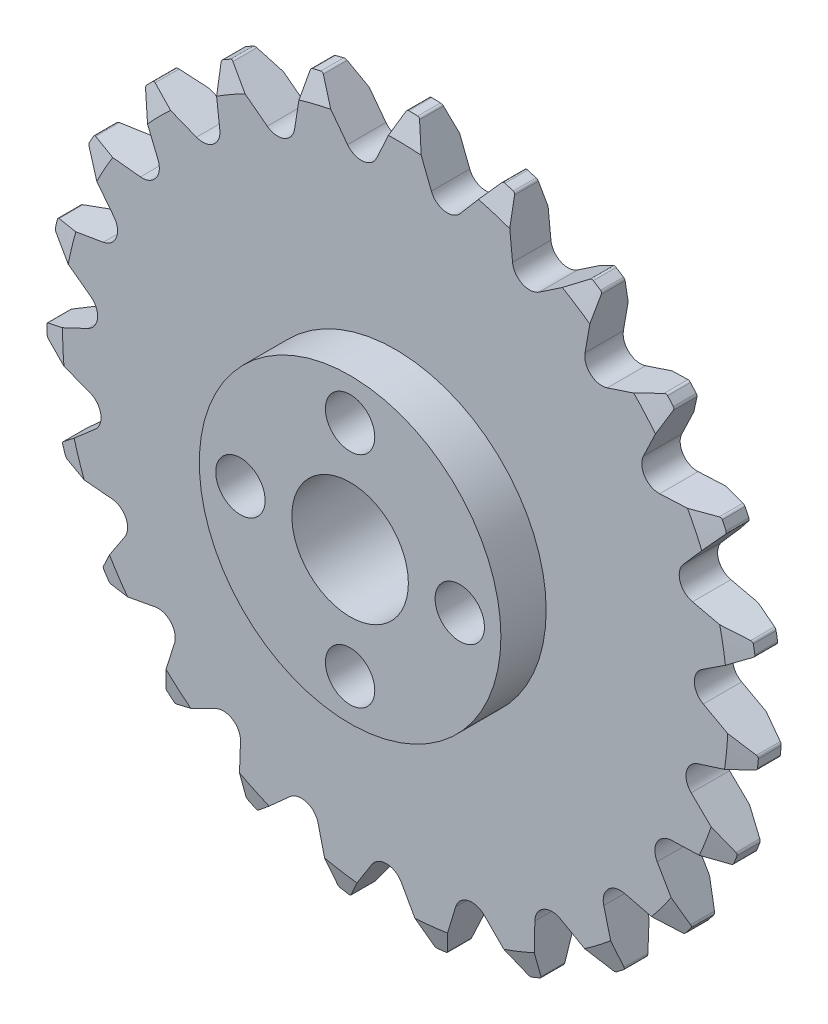
from build123d import *

# Parameters (mm, degrees)
SKETCH1_W                  = 26
SKETCH1_H                  = 2.7999944
CUT_EXTRUDE1_DEPTH         = 37.876008036
CUT_EXTRUDE2_DEPTH         = 37.876008036
CUT_EXTRUDE3_DEPTH         = 37.876008036
CUT_EXTRUDE4_DEPTH         = 37.876008036
CUT_EXTRUDE5_DEPTH         = 37.876008036
CUT_EXTRUDE6_DEPTH         = 37.876008036
CUT_EXTRUDE7_DEPTH         = 37.876008036
CUT_EXTRUDE8_DEPTH         = 37.876008036
CUT_EXTRUDE9_DEPTH         = 37.876008036
CUT_EXTRUDE10_DEPTH        = 37.876008036
CUT_EXTRUDE11_DEPTH        = 37.876008036
CUT_EXTRUDE12_DEPTH        = 37.876008036
CUT_EXTRUDE13_DEPTH        = 37.876008036
CUT_EXTRUDE14_DEPTH        = 37.876008036
CUT_EXTRUDE15_DEPTH        = 37.876008036
CUT_EXTRUDE16_DEPTH        = 37.871323245
CUT_EXTRUDE17_DEPTH        = 37.871323245
CUT_EXTRUDE18_DEPTH        = 37.871323245
CUT_EXTRUDE19_DEPTH        = 37.871323245
CUT_EXTRUDE20_DEPTH        = 37.871323245
CUT_EXTRUDE21_DEPTH        = 37.871323245
CUT_EXTRUDE22_DEPTH        = 37.870167928
CUT_EXTRUDE23_DEPTH        = 37.870167928
SKETCH25_W                 = 11
SKETCH25_H                 = 3.302
F_8_0_8_DIAMETER_HOLE1_D   = 8.5
F_3_6_3_6_DIAMETER_HOLE1_D = 3.6
F_3_6_3_6_DIAMETER_HOLE2_D = 3.6
FILLET1_R                  = 0.2


with BuildPart() as part:
    # Sketch1 → Revolve1 (revolve)
    with BuildSketch(Plane(origin=(0, 0, 0), x_dir=(1, 0, 0), z_dir=(0, 1, 0))):
        with Locations((13, 1.3999972)):
            Rectangle(SKETCH1_W, SKETCH1_H)
    revolve(axis=Axis((0, 0, -2.7999944), (0, 0, 1)))

    # Sketch2 → Cut-Extrude1 (cut, through all)
    with BuildSketch(Plane(origin=(0, 0, -2.7999944), x_dir=(-1, 0, 0), z_dir=(0, 0, -1))):
        with BuildLine():
            Line((18.801313039, 17.958580902), (17.308486788, 14.31139503))
            ThreePointArc((17.308486788, 14.31139503), (17.465043178, 13.088273063), (18.595024492, 12.594634046))
            Line((18.595024492, 12.594634046), (22.514630462, 13.003515492))
            ThreePointArc((22.514630462, 13.003515492), (20.80600791, 15.591986238), (18.801313039, 17.958580902))
        make_face()
    extrude(amount=-CUT_EXTRUDE1_DEPTH, mode=Mode.SUBTRACT)

    # Sketch3 → Cut-Extrude2 (cut, through all)
    with BuildSketch(Plane(origin=(0, 0, -2.7999944), x_dir=(-1, 0, 0), z_dir=(0, 0, -1))):
        with BuildLine():
            Line((22.949276492, 12.220094456), (20.527809316, 9.110915831))
            ThreePointArc((20.527809316, 9.110915831), (20.348565813, 7.890912137), (21.303462141, 7.110713283))
            Line((21.303462141, 7.110713283), (25.188033384, 6.446935261))
            ThreePointArc((25.188033384, 6.446935261), (24.24113224, 9.400399338), (22.949276492, 12.220094456))
        make_face()
    extrude(amount=-CUT_EXTRUDE2_DEPTH, mode=Mode.SUBTRACT)

    # Sketch4 → Cut-Extrude3 (cut, through all)
    with BuildSketch(Plane(origin=(0, 0, -2.7999944), x_dir=(-1, 0, 0), z_dir=(0, 0, -1))):
        with BuildLine():
            Line((25.395197093, 5.575299507), (22.224678136, 3.234721685))
            ThreePointArc((22.224678136, 3.234721685), (21.72292841, 2.108318355), (22.431919461, 1.099423446))
            Line((22.431919461, 1.099423446), (25.993355097, -0.587784666))
            ThreePointArc((25.993355097, -0.587784666), (25.878402688, 2.511627823), (25.395197093, 5.575299507))
        make_face()
    extrude(amount=-CUT_EXTRUDE3_DEPTH, mode=Mode.SUBTRACT)

    # Sketch5 → Cut-Extrude4 (cut, through all)
    with BuildSketch(Plane(origin=(0, 0, -2.7999944), x_dir=(-1, 0, 0), z_dir=(0, 0, -1))):
        with BuildLine():
            Line((25.957672102, -1.482989902), (22.273244249, -2.881376971))
            ThreePointArc((22.273244249, -2.881376971), (21.486200783, -3.830639754), (21.896703933, -4.993405599))
            Line((21.896703933, -4.993405599), (24.870868574, -7.578911293))
            ThreePointArc((24.870868574, -7.578911293), (25.596390394, -4.563419638), (25.957672102, -1.482989902))
        make_face()
    extrude(amount=-CUT_EXTRUDE4_DEPTH, mode=Mode.SUBTRACT)

    # Sketch6 → Cut-Extrude5 (cut, through all)
    with BuildSketch(Plane(origin=(0, 0, -2.7999944), x_dir=(-1, 0, 0), z_dir=(0, 0, -1))):
        with BuildLine():
            Line((24.594985319, -8.431292733), (20.669905729, -8.783777078))
            ThreePointArc((20.669905729, -8.783777078), (19.655939936, -9.485496836), (19.737510045, -10.715896595))
            Line((19.737510045, -10.715896595), (21.903823506, -14.00794474))
            ThreePointArc((21.903823506, -14.00794474), (23.416010921, -11.30001914), (24.594985319, -8.431292733))
        make_face()
    extrude(amount=-CUT_EXTRUDE5_DEPTH, mode=Mode.SUBTRACT)

    # Sketch7 → Cut-Extrude6 (cut, through all)
    with BuildSketch(Plane(origin=(0, 0, -2.7999944), x_dir=(-1, 0, 0), z_dir=(0, 0, -1))):
        with BuildLine():
            Line((21.40820099, -14.754285153), (17.53357486, -14.034724622))
            ThreePointArc((17.53357486, -14.034724622), (16.367887944, -14.436858011), (16.11447533, -15.643638561))
            Line((16.11447533, -15.643638561), (17.312272051, -19.398073008))
            ThreePointArc((17.312272051, -19.398073008), (19.498973038, -17.198547917), (21.40820099, -14.754285153))
        make_face()
    extrude(amount=-CUT_EXTRUDE6_DEPTH, mode=Mode.SUBTRACT)

    # Sketch8 → Cut-Extrude7 (cut, through all)
    with BuildSketch(Plane(origin=(0, 0, -2.7999944), x_dir=(-1, 0, 0), z_dir=(0, 0, -1))):
        with BuildLine():
            Line((16.633668329, -19.98301974), (13.096858955, -18.244780846))
            ThreePointArc((13.096858955, -18.244780846), (11.865904582, -18.317503472), (11.296303699, -19.411163421))
            Line((11.296303699, -19.411163421), (11.436748577, -23.349534942))
            ThreePointArc((11.436748577, -23.349534942), (14.135785527, -21.821539073), (16.633668329, -19.98301974))
        make_face()
    extrude(amount=-CUT_EXTRUDE7_DEPTH, mode=Mode.SUBTRACT)

    # Sketch9 → Cut-Extrude8 (cut, through all)
    with BuildSketch(Plane(origin=(0, 0, -2.7999944), x_dir=(-1, 0, 0), z_dir=(0, 0, -1))):
        with BuildLine():
            Line((10.625492582, -23.729705169), (7.688808935, -21.101705139))
            ThreePointArc((7.688808935, -21.101705139), (6.48388136, -20.839623497), (5.6403369, -21.739051089))
            Line((5.6403369, -21.739051089), (4.713013781, -25.569268685))
            ThreePointArc((4.713013781, -25.569268685), (7.724211471, -24.826126503), (10.625492582, -23.729705169))
        make_face()
    extrude(amount=-CUT_EXTRUDE8_DEPTH, mode=Mode.SUBTRACT)

    # Sketch10 → Cut-Extrude9 (cut, through all)
    with BuildSketch(Plane(origin=(0, 0, -2.7999944), x_dir=(-1, 0, 0), z_dir=(0, 0, -1))):
        with BuildLine():
            Line((3.829272659, -25.716466921), (1.71051513, -22.393612495))
            ThreePointArc((1.71051513, -22.393612495), (0.620978318, -21.816163983), (-0.433947885, -22.454652788))
            Line((-0.433947885, -22.454652788), (-2.360263687, -25.892646742))
            ThreePointArc((-2.360263687, -25.892646742), (0.739767985, -25.989473702), (3.829272659, -25.716466921))
        make_face()
    extrude(amount=-CUT_EXTRUDE9_DEPTH, mode=Mode.SUBTRACT)

    # Sketch11 → Cut-Extrude10 (cut, through all)
    with BuildSketch(Plane(origin=(0, 0, -2.7999944), x_dir=(-1, 0, 0), z_dir=(0, 0, -1))):
        with BuildLine():
            Line((-3.250946899, -25.795955967), (-4.394639757, -22.024688057))
            ThreePointArc((-4.394639757, -22.024688057), (-5.287979844, -21.174699388), (-6.47604874, -21.504895613))
            Line((-6.47604874, -21.504895613), (-9.258491195, -24.295685642))
            ThreePointArc((-9.258491195, -24.295685642), (-6.299540707, -25.225300531), (-3.250946899, -25.795955967))
        make_face()
    extrude(amount=-CUT_EXTRUDE10_DEPTH, mode=Mode.SUBTRACT)

    # Sketch12 → Cut-Extrude11 (cut, through all)
    with BuildSketch(Plane(origin=(0, 0, -2.7999944), x_dir=(-1, 0, 0), z_dir=(0, 0, -1))):
        with BuildLine():
            Line((-10.090058599, -23.962276968), (-10.173864317, -20.022293262))
            ThreePointArc((-10.173864317, -20.022293262), (-10.804752732, -18.962804207), (-12.037850686, -18.960218709))
            Line((-12.037850686, -18.960218709), (-15.470058766, -20.896824682))
            ThreePointArc((-15.470058766, -20.896824682), (-12.871641284, -22.590282217), (-10.090058599, -23.962276968))
        make_face()
    extrude(amount=-CUT_EXTRUDE11_DEPTH, mode=Mode.SUBTRACT)

    # Sketch13 → Cut-Extrude12 (cut, through all)
    with BuildSketch(Plane(origin=(0, 0, -2.7999944), x_dir=(-1, 0, 0), z_dir=(0, 0, -1))):
        with BuildLine():
            Line((-16.18083681, -20.351425506), (-15.198539903, -16.534936571))
            ThreePointArc((-15.198539903, -16.534936571), (-15.520186538, -15.344524588), (-16.706860316, -15.00934912))
            Line((-16.706860316, -15.00934912), (-20.534282848, -15.948141832))
            ThreePointArc((-20.534282848, -15.948141832), (-18.489111111, -18.279846015), (-16.18083681, -20.351425506))
        make_face()
    extrude(amount=-CUT_EXTRUDE12_DEPTH, mode=Mode.SUBTRACT)

    # Sketch14 → Cut-Extrude13 (cut, through all)
    with BuildSketch(Plane(origin=(0, 0, -2.7999944), x_dir=(-1, 0, 0), z_dir=(0, 0, -1))):
        with BuildLine():
            Line((-21.071556378, -15.231201916), (-19.096009313, -11.821259277))
            ThreePointArc((-19.096009313, -11.821259277), (-19.084559109, -10.588211776), (-20.136798545, -9.94530477))
            Line((-20.136798545, -9.94530477), (-24.07557311, -9.816658261))
            ThreePointArc((-24.07557311, -9.816658261), (-22.735328148, -12.613677259), (-21.071556378, -15.231201916))
        make_face()
    extrude(amount=-CUT_EXTRUDE13_DEPTH, mode=Mode.SUBTRACT)

    # Sketch15 → Cut-Extrude14 (cut, through all)
    with BuildSketch(Plane(origin=(0, 0, -2.7999944), x_dir=(-1, 0, 0), z_dir=(0, 0, -1))):
        with BuildLine():
            Line((-24.399495006, -8.981349757), (-21.577215071, -6.230853262))
            ThreePointArc((-21.577215071, -6.230853262), (-21.233517237, -5.046619734), (-22.073282546, -4.143662662))
            Line((-22.073282546, -4.143662662), (-25.831288253, -2.957118055))
            ThreePointArc((-25.831288253, -2.957118055), (-25.295369904, -6.012009764), (-24.399495006, -8.981349757))
        make_face()
    extrude(amount=-CUT_EXTRUDE14_DEPTH, mode=Mode.SUBTRACT)

    # Sketch16 → Cut-Extrude15 (cut, through all)
    with BuildSketch(Plane(origin=(0, 0, -2.7999944), x_dir=(-1, 0, 0), z_dir=(0, 0, -1))):
        with BuildLine():
            Line((-25.917834709, -2.065391975), (-22.458137497, -0.178333364))
            ThreePointArc((-22.458137497, -0.178333364), (-21.807682528, 0.869257006), (-22.372692159, 1.965295949))
            Line((-22.372692159, 1.965295949), (-25.671214916, 4.12173807))
            ThreePointArc((-25.671214916, 4.12173807), (-25.979369793, 1.035540992), (-25.917834709, -2.065391975))
        make_face()
    extrude(amount=-CUT_EXTRUDE15_DEPTH, mode=Mode.SUBTRACT)

    # Sketch17 → Cut-Extrude16 (cut, through all)
    with BuildSketch(Plane(origin=(0, 0, -2.7999944), x_dir=(-1, 0, 0), z_dir=(0, 0, -1))):
        with BuildLine():
            Line((-25.513967178, 5.003746482), (-21.673442603, 5.887412704))
            ThreePointArc((-21.673442603, 5.887412704), (-20.76447177, 6.720664931), (-21.012821543, 7.928497551))
            Line((-21.012821543, 7.928497551), (-23.607225007, 10.894903738))
            ThreePointArc((-23.607225007, 10.894903738), (-24.736598672, 8.00629041), (-25.513967178, 5.003746482))
        make_face()
    extrude(amount=-CUT_EXTRUDE16_DEPTH, mode=Mode.SUBTRACT)

    # Sketch18 → Cut-Extrude17 (cut, through all)
    with BuildSketch(Plane(origin=(0, 0, -2.7999944), x_dir=(-1, 0, 0), z_dir=(0, 0, -1))):
        with BuildLine():
            Line((-23.21784542, 11.701779953), (-19.281327621, 11.516516304))
            ThreePointArc((-19.281327621, 11.516516304), (-18.181255132, 12.073631883), (-18.09452608, 13.30367876))
            Line((-18.09452608, 13.30367876), (-19.792395215, 16.860044236))
            ThreePointArc((-19.792395215, 16.860044236), (-21.65922719, 14.383249894), (-23.21784542, 11.701779953))
        make_face()
    extrude(amount=-CUT_EXTRUDE17_DEPTH, mode=Mode.SUBTRACT)

    # Sketch19 → Cut-Extrude18 (cut, through all)
    with BuildSketch(Plane(origin=(0, 0, -2.7999944), x_dir=(-1, 0, 0), z_dir=(0, 0, -1))):
        with BuildLine():
            Line((-19.199762281, 17.531945937), (-15.459204775, 16.291492575))
            ThreePointArc((-15.459204775, 16.291492575), (-14.249617974, 16.531152791), (-13.834242395, 17.692186975))
            Line((-13.834242395, 17.692186975), (-14.509654015, 21.574752383))
            ThreePointArc((-14.509654015, 21.574752383), (-16.975489912, 19.693469533), (-19.199762281, 17.531945937))
        make_face()
    extrude(amount=-CUT_EXTRUDE18_DEPTH, mode=Mode.SUBTRACT)

    # Sketch20 → Cut-Extrude19 (cut, through all)
    with BuildSketch(Plane(origin=(0, 0, -2.7999944), x_dir=(-1, 0, 0), z_dir=(0, 0, -1))):
        with BuildLine():
            Line((-13.757720608, 22.061847694), (-10.490543432, 19.85820337))
            ThreePointArc((-10.490543432, 19.85820337), (-9.261151839, 19.762633722), (-8.547936239, 20.768546619))
            Line((-8.547936239, 20.768546619), (-8.150798153, 24.689359843))
            ThreePointArc((-8.150798153, 24.689359843), (-11.032758204, 23.543114628), (-13.757720608, 22.061847694))
        make_face()
    extrude(amount=-CUT_EXTRUDE19_DEPTH, mode=Mode.SUBTRACT)

    # Sketch21 → Cut-Extrude20 (cut, through all)
    with BuildSketch(Plane(origin=(0, 0, -2.7999944), x_dir=(-1, 0, 0), z_dir=(0, 0, -1))):
        with BuildLine():
            Line((-7.295331734, 24.955523134), (-4.743846474, 21.952122067))
            ThreePointArc((-4.743846474, 21.952122067), (-3.585828439, 21.528410517), (-2.627668756, 22.30459817))
            Line((-2.627668756, 22.30459817), (-1.187434879, 25.972870431))
            ThreePointArc((-1.187434879, 25.972870431), (-4.271777292, 25.646674614), (-7.295331734, 24.955523134))
        make_face()
    extrude(amount=-CUT_EXTRUDE20_DEPTH, mode=Mode.SUBTRACT)

    # Sketch22 → Cut-Extrude21 (cut, through all)
    with BuildSketch(Plane(origin=(0, 0, -2.7999944), x_dir=(-1, 0, 0), z_dir=(0, 0, -1))):
        with BuildLine():
            Line((-0.29188148, 25.998361587), (1.354679875, 22.417952294))
            ThreePointArc((1.354679875, 22.417952294), (2.355439453, 21.697523591), (3.487480897, 22.186419711))
            Line((3.487480897, 22.186419711), (5.863995007, 25.330092036))
            ThreePointArc((5.863995007, 25.330092036), (2.806021799, 25.84813807), (-0.29188148, 25.998361587))
        make_face()
    extrude(amount=-CUT_EXTRUDE21_DEPTH, mode=Mode.SUBTRACT)

    # Sketch23 → Cut-Extrude22 (cut, through all)
    with BuildSketch(Plane(origin=(0, 0, -2.7999944), x_dir=(-1, 0, 0), z_dir=(0, 0, -1))):
        with BuildLine():
            Line((6.733216289, 25.113020495), (7.352735815, 21.221145554))
            ThreePointArc((7.352735815, 21.221145554), (8.122015175, 20.257430599), (9.343980047, 20.422775999))
            Line((9.343980047, 20.422775999), (12.48051921, 22.808696593))
            ThreePointArc((12.48051921, 22.808696593), (9.675711091, 24.132563372), (6.733216289, 25.113020495))
        make_face()
    extrude(amount=-CUT_EXTRUDE22_DEPTH, mode=Mode.SUBTRACT)

    # Sketch24 → Cut-Extrude23 (cut, through all)
    with BuildSketch(Plane(origin=(0, 0, -2.7999944), x_dir=(-1, 0, 0), z_dir=(0, 0, -1))):
        with BuildLine():
            Line((13.258942208, 22.365161558), (12.805472976, 18.45046353))
            ThreePointArc((12.805472976, 18.45046353), (13.286218188, 17.314936652), (14.507478942, 17.144468418))
            Line((14.507478942, 17.144468418), (18.171420397, 18.595684466))
            ThreePointArc((18.171420397, 18.595684466), (15.827797154, 20.627186848), (13.258942208, 22.365161558))
        make_face()
    extrude(amount=-CUT_EXTRUDE23_DEPTH, mode=Mode.SUBTRACT)

    # Sketch25 → Revolve2 (revolve)
    with BuildSketch(Plane(origin=(0, 0, 0), x_dir=(1, 0, 0), z_dir=(0, 1, 0))):
        with Locations((5.5, -1.651)):
            Rectangle(SKETCH25_W, SKETCH25_H)
    revolve(axis=Axis((0, 0, 0), (0, 0, 1)))

    # Ø8.0 (8) Diameter Hole1 (through all)
    with Locations(Plane.XY.offset(3.302)):
        with Locations((0, 0)):
            Hole(F_8_0_8_DIAMETER_HOLE1_D / 2)

    # Ø3.6 (3.6) Diameter Hole1 (through all)
    with Locations(Plane.XY.offset(3.302)):
        with Locations((0, 8), (-8, 0), (0, -8)):
            Hole(F_3_6_3_6_DIAMETER_HOLE1_D / 2)

    # Ø3.6 (3.6) Diameter Hole2 (through all)
    with Locations(Plane(origin=(0, 0, -2.7999944), x_dir=(-1, 0, 0), z_dir=(0, 0, -1))):
        with Locations((-8, 0)):
            Hole(F_3_6_3_6_DIAMETER_HOLE2_D / 2)

    # Fillet1
    fillet1_edges = [part.edges().sort_by_distance(p)[0] for p in [
        (25.831288253, -2.957118055, -1.3999972),
        (25.917834709, -2.065391975, -1.3999972),
        (9.258491195, -24.295685642, -1.3999972),
        (10.090058599, -23.962276968, -1.3999972),
        (14.509654015, 21.574752383, -1.3999972),
        (13.757720608, 22.061847694, -1.3999972),
        (-13.258942208, 22.365161558, -1.3999972),
        (-12.48051921, 22.808696593, -1.3999972),
        (20.534282848, -15.948141832, -1.3999972),
        (21.071556378, -15.231201916, -1.3999972),
        (-18.801313039, 17.958580902, -1.3999972),
        (-18.171420397, 18.595684466, -1.3999972),
        (23.607225007, 10.894903738, -1.3999972),
        (23.21784542, 11.701779953, -1.3999972),
        (1.187434879, 25.972870431, -1.3999972),
        (0.29188148, 25.998361587, -1.3999972),
        (-22.949276492, 12.220094456, -1.3999972),
        (-22.514630462, 13.003515492, -1.3999972),
        (15.470058766, -20.896824682, -1.3999972),
        (16.18083681, -20.351425506, -1.3999972),
        (24.07557311, -9.816658261, -1.3999972),
        (24.399495006, -8.981349757, -1.3999972),
        (-25.395197093, 5.575299507, -1.3999972),
        (-25.188033384, 6.446935261, -1.3999972),
        (25.671214916, 4.12173807, -1.3999972),
        (25.513967178, 5.003746482, -1.3999972),
        (19.792395215, 16.860044236, -1.3999972),
        (19.199762281, 17.531945937, -1.3999972),
        (-25.957672102, -1.482989902, -1.3999972),
        (-25.993355097, -0.587784666, -1.3999972),
        (8.150798153, 24.689359843, -1.3999972),
        (7.295331734, 24.955523134, -1.3999972),
        (-5.863995007, 25.330092036, -1.3999972),
        (-6.733216289, 25.113020495, -1.3999972),
        (-24.594985319, -8.431292733, -1.3999972),
        (-24.870868574, -7.578911293, -1.3999972),
        (-21.40820099, -14.754285153, -1.3999972),
        (-21.903823506, -14.00794474, -1.3999972),
        (-16.633668329, -19.98301974, -1.3999972),
        (-17.312272051, -19.398073008, -1.3999972),
        (-10.625492582, -23.729705169, -1.3999972),
        (-11.436748577, -23.349534942, -1.3999972),
        (-3.829272659, -25.716466921, -1.3999972),
        (-4.713013781, -25.569268685, -1.3999972),
        (3.250946899, -25.795955967, -1.3999972),
        (2.360263687, -25.892646742, -1.3999972),
    ]]
    fillet(fillet1_edges, radius=FILLET1_R)

    # Sketch32 → Cut-Revolve1 (revolve, cut)
    with BuildSketch(Plane(origin=(0, 0, 0), x_dir=(0, 0, -1), z_dir=(1, 0, 0))):
        Polygon((0, 24.2697), (0, 26.0477), (0.5842, 26.0477), align=None)
        Polygon((2.2157944, 26.0477), (2.7999944, 24.2697), (2.7999944, 26.0477), align=None)
    revolve(axis=Axis((0, 0, 0), (0, 0, -1)), mode=Mode.SUBTRACT)


solid = part.part
